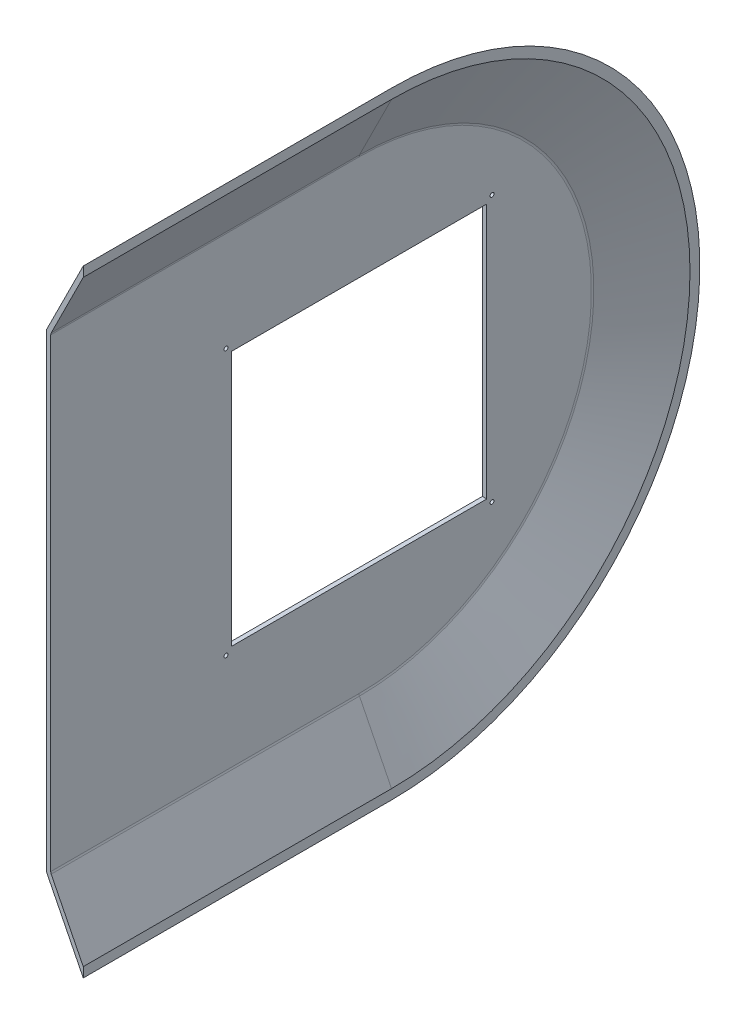
from build123d import *

# Parameters (mm, degrees)
REVOLVE1_ANGLE           = 180
BOSS_EXTRUDE1_DEPTH      = 350
SHELL2_T                 = -5
SKETCH4_W                = 290
SKETCH4_H                = 290
CUT_EXTRUDE1_DEPTH       = 497.747272869
M4_CLEARANCE_HOLE1_D     = 4.5
M4_CLEARANCE_HOLE1_DEPTH = 30
M4_CLEARANCE_HOLE1_TIP   = 1.351936393
FILLET1_R                = 5


with BuildPart() as part:
    # Esquisse2 → Revolve1 (revolve)
    with BuildSketch(Plane.XY):
        Polygon((41.926758797, 350), (41.926758797, 0), (0, 0), (0, 266.190547052), align=None)
    revolve(axis=Axis((41.926758797, 0, 0), (-1, 0, 0)), revolution_arc=REVOLVE1_ANGLE)

    # Sketch5 → Boss-Extrude1 (add)
    with BuildSketch(Plane.XY):
        Polygon((0, 266.190547052), (41.926758797, 350), (41.926758797, -350), (0, -266.190547052), align=None)
    extrude(amount=BOSS_EXTRUDE1_DEPTH)

    # Shell2
    shell2_openings = [part.faces().sort_by_distance(p)[0] for p in [
        (41.926758797, 0, 32.672450622),
        (21.913804754, 0, 350),
    ]]
    offset(amount=SHELL2_T, openings=shell2_openings, kind=Kind.INTERSECTION)

    # Sketch4 → Cut-Extrude1 (cut, through all)
    with BuildSketch(Plane.ZY):
        Rectangle(SKETCH4_W, SKETCH4_H)
    extrude(amount=-CUT_EXTRUDE1_DEPTH, mode=Mode.SUBTRACT)

    # M4 Clearance Hole1
    with Locations(Plane.ZY):
        with Locations((151, 151), (151, -151), (-151, -151), (-151, 151)):
            Hole(M4_CLEARANCE_HOLE1_D / 2, depth=M4_CLEARANCE_HOLE1_DEPTH)
            with Locations((0, 0, -(M4_CLEARANCE_HOLE1_DEPTH + M4_CLEARANCE_HOLE1_TIP / 2))):  # 118° drill point
                Cone(0, M4_CLEARANCE_HOLE1_D / 2, M4_CLEARANCE_HOLE1_TIP, mode=Mode.SUBTRACT)

    # Fillet1
    fillet1_edges = [part.edges().sort_by_distance(p)[0] for p in [
        (5, -265.009652137, 175),
        (5, 0, -265.009652137),
        (5, 265.009652137, 175),
        (0, -266.190547052, 175),
        (0, 0, -266.190547052),
        (0, 266.190547052, 175),
    ]]
    fillet(fillet1_edges, radius=FILLET1_R)


solid = part.part
